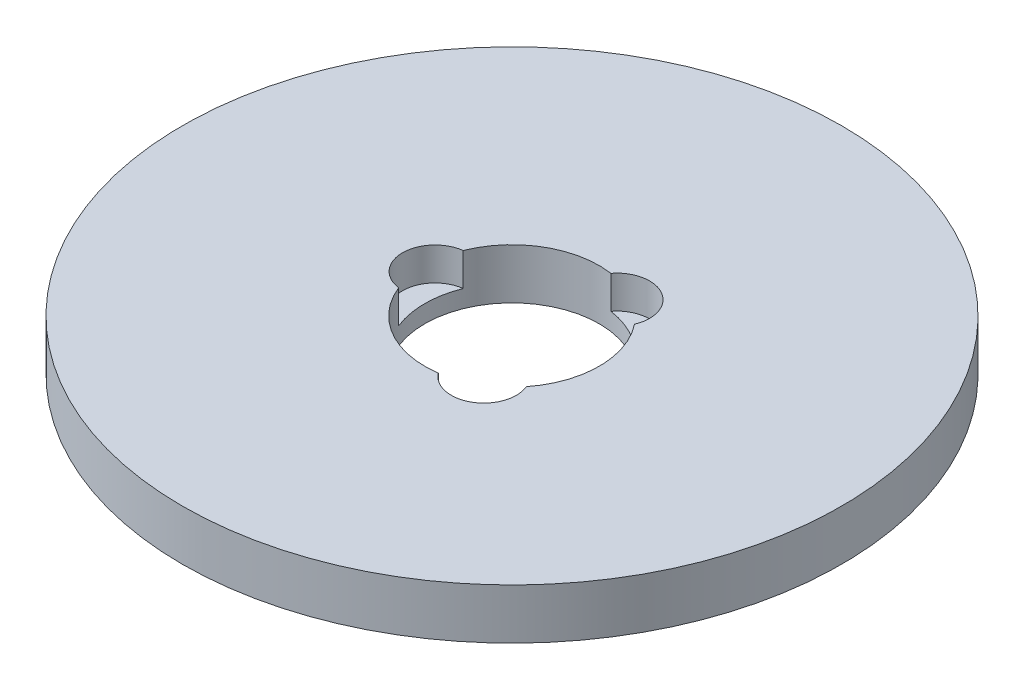
from build123d import *

# Parameters (mm, degrees)
SKETCH1_R           = 85
BOSS_EXTRUDE1_DEPTH = 13
SKETCH2_R           = 22.5
CUT_EXTRUDE1_DEPTH  = 121.909056733
SKETCH3_R           = 8.38688524
CUT_EXTRUDE2_DEPTH  = 8.489541422
CIRPATTERN1_COUNT   = 3


with BuildPart() as part:
    # Sketch1 → Boss-Extrude1 (new body)
    with BuildSketch(Plane(origin=(0, 0, 0), x_dir=(1, 0, 0), z_dir=(0, 1, 0))):
        Circle(SKETCH1_R)
    extrude(amount=BOSS_EXTRUDE1_DEPTH)

    # Sketch2 → Cut-Extrude1 (cut, through all)
    with BuildSketch(Plane(origin=(0, 0, 0), x_dir=(1, 0, 0), z_dir=(0, 1, 0))):
        Circle(SKETCH2_R)
    extrude(amount=CUT_EXTRUDE1_DEPTH, mode=Mode.SUBTRACT)

    # Sketch3 → Cut-Extrude2 (cut)
    with BuildSketch(Plane(origin=(0, 13, 0), x_dir=(1, 0, 0), z_dir=(0, 1, 0))):
        with Locations((-19.83941619, 0)):
            Circle(SKETCH3_R)
    cut_extrude2 = extrude(amount=-CUT_EXTRUDE2_DEPTH, mode=Mode.SUBTRACT)

    # CirPattern1: Cut-Extrude2 ×3 about axis
    cirpattern1_axis = Axis((0, 0, 0), (0, 1, 0))
    for i in range(1, CIRPATTERN1_COUNT):
        add(cut_extrude2.rotate(cirpattern1_axis, i * 360 / CIRPATTERN1_COUNT), mode=Mode.SUBTRACT)


solid = part.part
